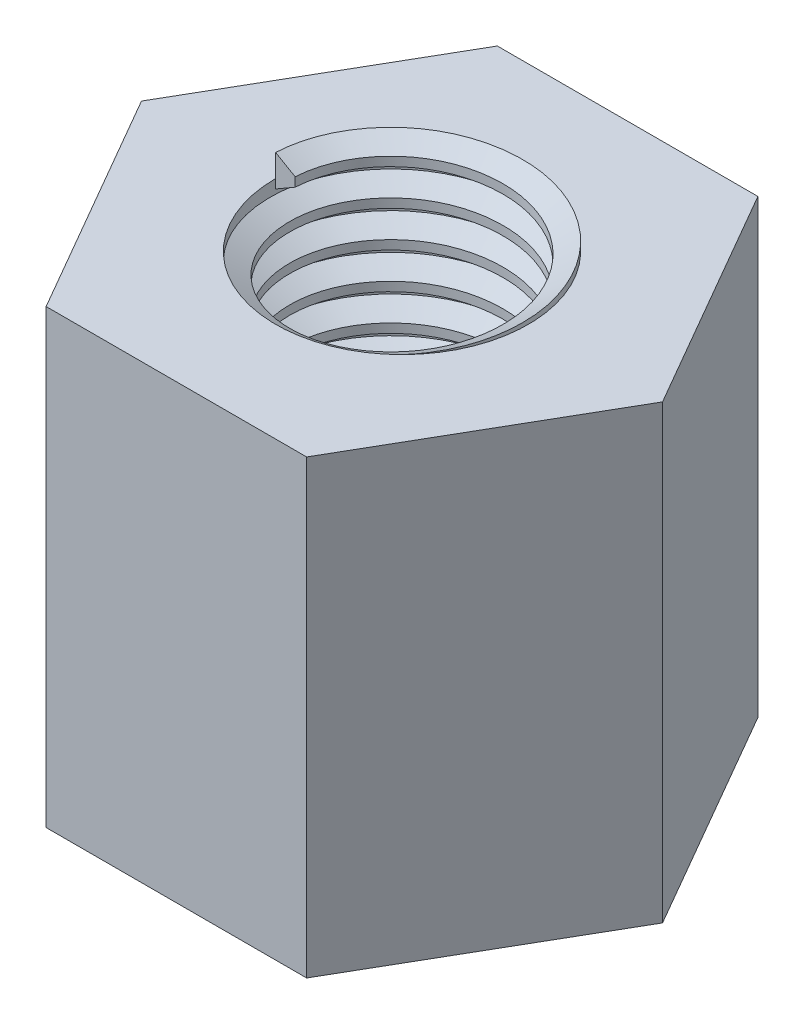
from build123d import *

# Parameters (mm, degrees)
SKETCH1_R           = 2.8
BOSS_EXTRUDE1_DEPTH = 10
THREAD1_PITCH       = 0.8


with BuildPart() as part:
    # Sketch1 → Boss-Extrude1 (new body)
    with BuildSketch(Plane(origin=(0, 0, 0), x_dir=(1, 0, 0), z_dir=(0, 1, 0))):
        Polygon((5.773502692, 0), (2.886751346, 5), (-2.886751346, 5), (-5.773502692, 0), (-2.886751346, -5), (2.886751346, -5), align=None)
        with Locations(Location((0, 0, 0), (0, 0, 270))):
            Circle(SKETCH1_R, mode=Mode.SUBTRACT)
    extrude(amount=BOSS_EXTRUDE1_DEPTH)

    # Thread1: the profile of Thread Profile1 profile screwed along a right-hand helix of 13.75 turns, 8 arcs to a turn; built about Z, then put on its axis
    thread1_z = Axis((0, 0, 0), (0, 0, 1))
    thread1_corners = [(2.8006, 0, -0.00034641), (2.8006, 0, 0.700346408), (2.3669873, 0, 0.449999999), (2.3669873, 0, 0.249999999)]
    with BuildLine(mode=Mode.PRIVATE) as thread1_profile:
        Line(thread1_corners[0], thread1_corners[1])
        Line(thread1_corners[1], thread1_corners[2])
        Line(thread1_corners[2], thread1_corners[3])
        Line(thread1_corners[3], thread1_corners[0])
    thread1_cap = Face(thread1_profile.wire())
    thread1_turn_angles = [0, 22.5, 45, 67.5, 90, 112.5, 135, 157.5, 180, 202.5, 225, 247.5, 270, 292.5, 315, 337.5, 360]
    thread1_turn_weights = [1, 0.9238795325112867, 1, 0.9238795325112867, 1, 0.9238795325112867, 1, 0.9238795325112867, 1, 0.9238795325112867, 1, 0.9238795325112867, 1, 0.9238795325112867, 1, 0.9238795325112867, 1]
    thread1_turn_rails = [Edge.make_bspline([Vector(p[0], p[1], 0).rotate(thread1_z, thread1_turn_angles[k]) / thread1_turn_weights[k] + Vector(0, 0, p[2] + THREAD1_PITCH * thread1_turn_angles[k] / 360) for k in range(17)], [0, 0, 0, 1, 1, 2, 2, 3, 3, 4, 4, 5, 5, 6, 6, 7, 7, 8, 8, 8], 2, thread1_turn_weights) for p in thread1_corners]
    thread1_turn_sides = [Face.make_surface_from_curves(thread1_turn_rails[p[0]], thread1_turn_rails[p[1]]) for p in [(0, 1), (1, 2), (2, 3), (3, 0)]]
    thread1_last_angles = [4680, 4702.5, 4725, 4747.5, 4770, 4792.5, 4815, 4837.5, 4860, 4882.5, 4905, 4927.5, 4950]
    thread1_last_weights = [1, 0.9238795325112867, 1, 0.9238795325112867, 1, 0.9238795325112867, 1, 0.9238795325112867, 1, 0.9238795325112867, 1, 0.9238795325112867, 1]
    thread1_last_rails = [Edge.make_bspline([Vector(p[0], p[1], 0).rotate(thread1_z, thread1_last_angles[k]) / thread1_last_weights[k] + Vector(0, 0, p[2] + THREAD1_PITCH * thread1_last_angles[k] / 360) for k in range(13)], [0, 0, 0, 1, 1, 2, 2, 3, 3, 4, 4, 5, 5, 6, 6, 6], 2, thread1_last_weights) for p in thread1_corners]
    thread1_last_sides = [Face.make_surface_from_curves(thread1_last_rails[p[0]], thread1_last_rails[p[1]]) for p in [(0, 1), (1, 2), (2, 3), (3, 0)]]
    thread1 = Plane(origin=(0, 10.5, 0), x_dir=(-1, 0, 0), z_dir=(0, -1, 0)) * Solid(Shell([*[p.moved(Location((0, 0, THREAD1_PITCH * i))) for i in range(13) for p in thread1_turn_sides], *thread1_last_sides, thread1_cap, thread1_cap.rotate(thread1_z, 4950).moved(Location((0, 0, THREAD1_PITCH * 4950 / 360)))]))
    add(thread1)


solid = part.part
